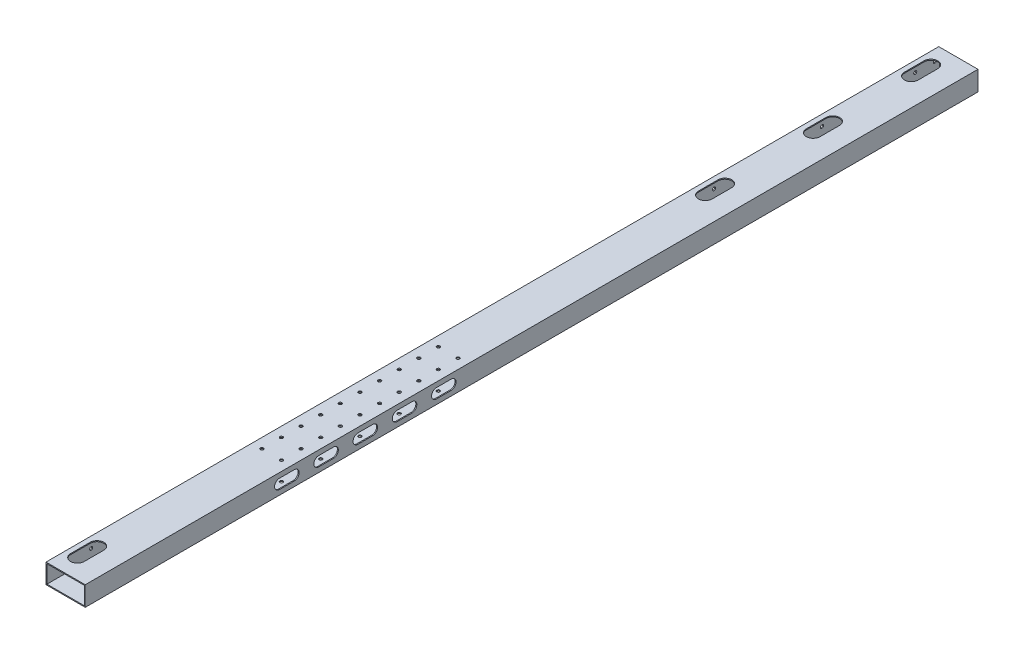
from build123d import *

# Parameters (mm, degrees)
SKETCH_1_W          = 40
SKETCH_1_H          = 20
SKETCH_1_W_2        = 38
SKETCH_1_H_2        = 18
EXTRUDE_1_DEPTH     = 910
CUT_EXTRUDE_1_REACH = 913.098
SKETCH_2_R          = 1.6
SKETCH_3_R          = 1.6
CUT_EXTRUDE_2_DEPTH = 10
CUT_EXTRUDE_4_DEPTH = 10
SKETCH_6_R          = 1.6
CUT_EXTRUDE_5_DEPTH = 912.098238391
CUT_EXTRUDE_6_REACH = 913.098


with BuildPart() as part:
    # 草图1 → 拉伸-薄壁1 (new body)
    with BuildSketch(Plane.XY):
        with Locations((-20, 10)):
            Rectangle(SKETCH_1_W, SKETCH_1_H)
        with Locations((-20, 10)):
            Rectangle(SKETCH_1_W_2, SKETCH_1_H_2, mode=Mode.SUBTRACT)
    extrude(amount=EXTRUDE_1_DEPTH)

    # 草图2 → 切除-拉伸1 (cut, up to next)
    with BuildSketch(Plane.ZY.offset(40), mode=Mode.PRIVATE) as cut_extrude_1_sk1:
        with Locations((865, 10)):
            Circle(SKETCH_2_R)
    cut_extrude_1_tool1 = extrude(cut_extrude_1_sk1.sketch, amount=-CUT_EXTRUDE_1_REACH, mode=Mode.PRIVATE) & part.part
    # 草图2 → 切除-拉伸1 (cut, up to next)
    with BuildSketch(Plane.ZY.offset(40), mode=Mode.PRIVATE) as cut_extrude_1_sk2:
        with Locations((845, 10)):
            Circle(SKETCH_2_R)
    cut_extrude_1_tool2 = extrude(cut_extrude_1_sk2.sketch, amount=-CUT_EXTRUDE_1_REACH, mode=Mode.PRIVATE) & part.part
    # 草图2 → 切除-拉伸1 (cut, up to next)
    with BuildSketch(Plane.ZY.offset(40), mode=Mode.PRIVATE) as cut_extrude_1_sk3:
        with Locations((825, 10)):
            Circle(SKETCH_2_R)
    cut_extrude_1_tool3 = extrude(cut_extrude_1_sk3.sketch, amount=-CUT_EXTRUDE_1_REACH, mode=Mode.PRIVATE) & part.part
    # 草图2 → 切除-拉伸1 (cut, up to next)
    with BuildSketch(Plane.ZY.offset(40), mode=Mode.PRIVATE) as cut_extrude_1_sk4:
        with Locations((45, 10)):
            Circle(SKETCH_2_R)
    cut_extrude_1_tool4 = extrude(cut_extrude_1_sk4.sketch, amount=-CUT_EXTRUDE_1_REACH, mode=Mode.PRIVATE) & part.part
    # 草图2 → 切除-拉伸1 (cut, up to next)
    with BuildSketch(Plane.ZY.offset(40), mode=Mode.PRIVATE) as cut_extrude_1_sk5:
        with Locations((25, 10)):
            Circle(SKETCH_2_R)
    cut_extrude_1_tool5 = extrude(cut_extrude_1_sk5.sketch, amount=-CUT_EXTRUDE_1_REACH, mode=Mode.PRIVATE) & part.part
    # 草图2 → 切除-拉伸1 (cut, up to next)
    with BuildSketch(Plane.ZY.offset(40), mode=Mode.PRIVATE) as cut_extrude_1_sk6:
        with Locations((5, 10)):
            Circle(SKETCH_2_R)
    cut_extrude_1_tool6 = extrude(cut_extrude_1_sk6.sketch, amount=-CUT_EXTRUDE_1_REACH, mode=Mode.PRIVATE) & part.part
    add(cut_extrude_1_tool1.solids().sort_by_distance((-40, 10, 865))[0], mode=Mode.SUBTRACT)
    add(cut_extrude_1_tool2.solids().sort_by_distance((-40, 10, 845))[0], mode=Mode.SUBTRACT)
    add(cut_extrude_1_tool3.solids().sort_by_distance((-40, 10, 825))[0], mode=Mode.SUBTRACT)
    add(cut_extrude_1_tool4.solids().sort_by_distance((-40, 10, 45))[0], mode=Mode.SUBTRACT)
    add(cut_extrude_1_tool5.solids().sort_by_distance((-40, 10, 25))[0], mode=Mode.SUBTRACT)
    add(cut_extrude_1_tool6.solids().sort_by_distance((-40, 10, 5))[0], mode=Mode.SUBTRACT)

    # 草图3 → 切除-拉伸2 (cut)
    with BuildSketch(Plane.ZY.offset(40)):
        with Locations((120, 10)):
            Circle(SKETCH_3_R)
        with Locations((140, 10)):
            Circle(SKETCH_3_R)
        with Locations((230, 10)):
            Circle(SKETCH_3_R)
        with Locations((250, 10)):
            Circle(SKETCH_3_R)
    extrude(amount=-CUT_EXTRUDE_2_DEPTH, mode=Mode.SUBTRACT)

    # 草图5 → 切除-拉伸4 (cut)
    with BuildSketch(Plane(origin=(0, 20, 0), x_dir=(1, 0, 0), z_dir=(0, 1, 0))):
        with BuildLine():
            Line((-21, -120), (-21, -140))
            ThreePointArc((-21, -140), (-28, -147), (-35, -140))
            Line((-35, -140), (-35, -120))
            ThreePointArc((-35, -120), (-28, -113), (-21, -120))
        make_face()
        with BuildLine():
            Line((-21, -230), (-21, -250))
            ThreePointArc((-21, -250), (-28, -257), (-35, -250))
            Line((-35, -250), (-35, -230))
            ThreePointArc((-35, -230), (-28, -223), (-21, -230))
        make_face()
        with BuildLine():
            Line((-21, -20), (-21, -40))
            ThreePointArc((-21, -40), (-28, -47), (-35, -40))
            Line((-35, -40), (-35, -20))
            ThreePointArc((-35, -20), (-28, -13), (-21, -20))
        make_face()
        with BuildLine():
            Line((-21, -870), (-21, -890))
            ThreePointArc((-21, -890), (-28, -897), (-35, -890))
            Line((-35, -890), (-35, -870))
            ThreePointArc((-35, -870), (-28, -863), (-21, -870))
        make_face()
    extrude(amount=-CUT_EXTRUDE_4_DEPTH, mode=Mode.SUBTRACT)

    # 草图6 → 切除-拉伸5 (cut, through all)
    with BuildSketch(Plane(origin=(0, 20, 0), x_dir=(1, 0, 0), z_dir=(0, 1, 0))):
        with Locations((-30, -700)):
            Circle(SKETCH_6_R)
        with Locations((-10, -700)):
            Circle(SKETCH_6_R)
        with Locations((-10, -680)):
            Circle(SKETCH_6_R)
        with Locations((-10, -660)):
            Circle(SKETCH_6_R)
        with Locations((-10, -640)):
            Circle(SKETCH_6_R)
        with Locations((-10, -620)):
            Circle(SKETCH_6_R)
        with Locations((-10, -600)):
            Circle(SKETCH_6_R)
        with Locations((-10, -580)):
            Circle(SKETCH_6_R)
        with Locations((-10, -560)):
            Circle(SKETCH_6_R)
        with Locations((-10, -540)):
            Circle(SKETCH_6_R)
        with Locations((-10, -520)):
            Circle(SKETCH_6_R)
        with Locations((-30, -680)):
            Circle(SKETCH_6_R)
        with Locations((-30, -660)):
            Circle(SKETCH_6_R)
        with Locations((-30, -640)):
            Circle(SKETCH_6_R)
        with Locations((-30, -620)):
            Circle(SKETCH_6_R)
        with Locations((-30, -600)):
            Circle(SKETCH_6_R)
        with Locations((-30, -580)):
            Circle(SKETCH_6_R)
        with Locations((-30, -560)):
            Circle(SKETCH_6_R)
        with Locations((-30, -540)):
            Circle(SKETCH_6_R)
        with Locations((-30, -520)):
            Circle(SKETCH_6_R)
    extrude(amount=-CUT_EXTRUDE_5_DEPTH, mode=Mode.SUBTRACT)

    # 草图7 → 切除-拉伸6 (cut, up to next)
    with BuildSketch(Plane(origin=(0, 0, 0), x_dir=(0, 0, -1), z_dir=(1, 0, 0)), mode=Mode.PRIVATE) as cut_extrude_6_sk1:
        with BuildLine():
            Line((-712, 15), (-697, 15))
            ThreePointArc((-697, 15), (-692, 10), (-697, 5))
            Line((-697, 5), (-712, 5))
            ThreePointArc((-712, 5), (-717, 10), (-712, 15))
        make_face()
    cut_extrude_6_tool1 = extrude(cut_extrude_6_sk1.sketch, amount=-CUT_EXTRUDE_6_REACH, mode=Mode.PRIVATE) & part.part
    # 草图7 → 切除-拉伸6 (cut, up to next)
    with BuildSketch(Plane(origin=(0, 0, 0), x_dir=(0, 0, -1), z_dir=(1, 0, 0)), mode=Mode.PRIVATE) as cut_extrude_6_sk2:
        with BuildLine():
            Line((-672, 15), (-657, 15))
            ThreePointArc((-657, 15), (-652, 10), (-657, 5))
            Line((-657, 5), (-672, 5))
            ThreePointArc((-672, 5), (-677, 10), (-672, 15))
        make_face()
    cut_extrude_6_tool2 = extrude(cut_extrude_6_sk2.sketch, amount=-CUT_EXTRUDE_6_REACH, mode=Mode.PRIVATE) & part.part
    # 草图7 → 切除-拉伸6 (cut, up to next)
    with BuildSketch(Plane(origin=(0, 0, 0), x_dir=(0, 0, -1), z_dir=(1, 0, 0)), mode=Mode.PRIVATE) as cut_extrude_6_sk3:
        with BuildLine():
            Line((-632, 15), (-617, 15))
            ThreePointArc((-617, 15), (-612, 10), (-617, 5))
            Line((-617, 5), (-632, 5))
            ThreePointArc((-632, 5), (-637, 10), (-632, 15))
        make_face()
    cut_extrude_6_tool3 = extrude(cut_extrude_6_sk3.sketch, amount=-CUT_EXTRUDE_6_REACH, mode=Mode.PRIVATE) & part.part
    # 草图7 → 切除-拉伸6 (cut, up to next)
    with BuildSketch(Plane(origin=(0, 0, 0), x_dir=(0, 0, -1), z_dir=(1, 0, 0)), mode=Mode.PRIVATE) as cut_extrude_6_sk4:
        with BuildLine():
            Line((-592, 15), (-577, 15))
            ThreePointArc((-577, 15), (-572, 10), (-577, 5))
            Line((-577, 5), (-592, 5))
            ThreePointArc((-592, 5), (-597, 10), (-592, 15))
        make_face()
    cut_extrude_6_tool4 = extrude(cut_extrude_6_sk4.sketch, amount=-CUT_EXTRUDE_6_REACH, mode=Mode.PRIVATE) & part.part
    # 草图7 → 切除-拉伸6 (cut, up to next)
    with BuildSketch(Plane(origin=(0, 0, 0), x_dir=(0, 0, -1), z_dir=(1, 0, 0)), mode=Mode.PRIVATE) as cut_extrude_6_sk5:
        with BuildLine():
            Line((-552, 15), (-537, 15))
            ThreePointArc((-537, 15), (-532, 10), (-537, 5))
            Line((-537, 5), (-552, 5))
            ThreePointArc((-552, 5), (-557, 10), (-552, 15))
        make_face()
    cut_extrude_6_tool5 = extrude(cut_extrude_6_sk5.sketch, amount=-CUT_EXTRUDE_6_REACH, mode=Mode.PRIVATE) & part.part
    add(cut_extrude_6_tool1.solids().sort_by_distance((0, 10, 704.5))[0], mode=Mode.SUBTRACT)
    add(cut_extrude_6_tool2.solids().sort_by_distance((0, 10, 664.5))[0], mode=Mode.SUBTRACT)
    add(cut_extrude_6_tool3.solids().sort_by_distance((0, 10, 624.5))[0], mode=Mode.SUBTRACT)
    add(cut_extrude_6_tool4.solids().sort_by_distance((0, 10, 584.5))[0], mode=Mode.SUBTRACT)
    add(cut_extrude_6_tool5.solids().sort_by_distance((0, 10, 544.5))[0], mode=Mode.SUBTRACT)


solid = part.part
